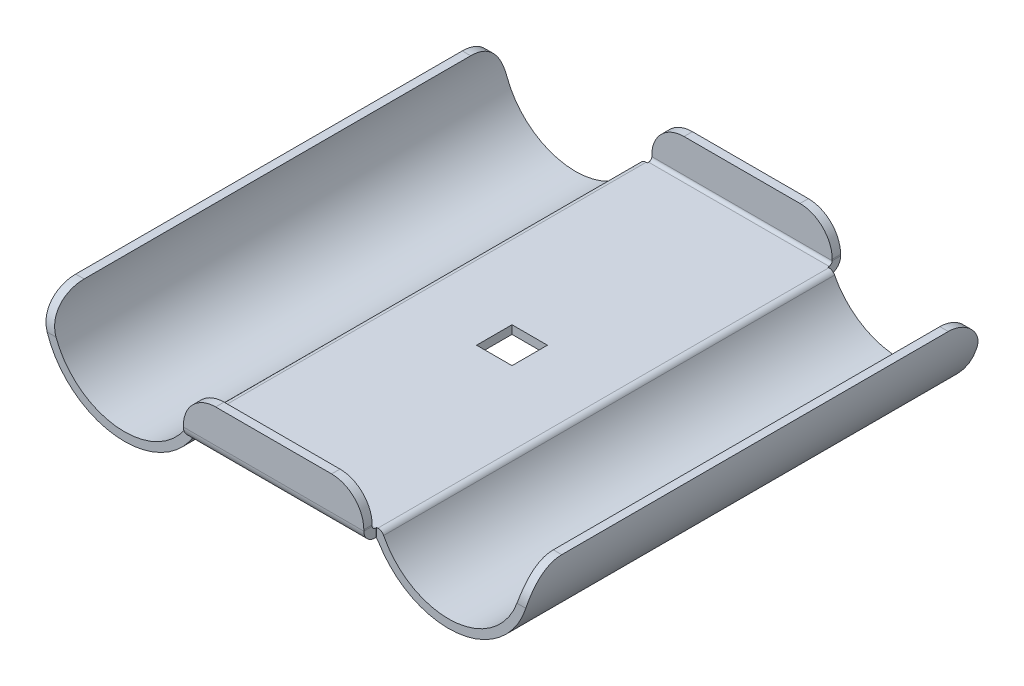
from build123d import *

# Parameters (mm, degrees)
SKETCH1_W                      = 28
SKETCH1_H                      = 74
BOSS_EXTRUDE1_DEPTH            = 1.3
EDGE_FLANGE1_STRIP_W           = 6.2
EDGE_FLANGE1_STRIP_H           = 1.3
EDGE_FLANGE1_STRIP_CUT_DEPTH   = 28
EDGE_FLANGE1_STRIP_2_W         = 6.2
EDGE_FLANGE1_STRIP_2_H         = 1.3
EDGE_FLANGE1_STRIP_CUT_2_DEPTH = 28
EDGE_FLANGE1_DEPTH             = 28
EDGE_FLANGE1_BEND_DEPTH        = 28
FILLET1_R                      = 5
SKETCH16_W                     = 5.5
SKETCH16_H                     = 5.5
CUT_EXTRUDE1_DEPTH             = 41.174618853
BOSS_EXTRUDE2_DEPTH            = 35
FILLET2_R                      = 5
FILLET3_R                      = 1


# Sheet-metal steps are written as plain solids
with BuildPart() as part:
    # Sketch1 → Boss-Extrude1 (new body)
    with BuildSketch(Plane(origin=(0, 0, 0), x_dir=(1, 0, 0), z_dir=(0, 1, 0))):
        Rectangle(SKETCH1_W, SKETCH1_H)
    extrude(amount=BOSS_EXTRUDE1_DEPTH)

    # Edge-Flange1 strip (across the edge) → Edge-Flange1 strip cut (cut)
    with BuildSketch(Plane(origin=(14, 1.3, -37), x_dir=(0, 0, 1), z_dir=(-1, 0, 0))):
        with Locations((-1.3, -0.65)):
            Rectangle(EDGE_FLANGE1_STRIP_W, EDGE_FLANGE1_STRIP_H)
    extrude(amount=EDGE_FLANGE1_STRIP_CUT_DEPTH, mode=Mode.SUBTRACT)

    # Edge-Flange1 strip 2 (across the edge) → Edge-Flange1 strip cut 2 (cut)
    with BuildSketch(Plane(origin=(-14, 1.3, 37), x_dir=(0, 0, -1), z_dir=(1, 0, 0))):
        with Locations((-1.3, -0.65)):
            Rectangle(EDGE_FLANGE1_STRIP_2_W, EDGE_FLANGE1_STRIP_2_H)
    extrude(amount=EDGE_FLANGE1_STRIP_CUT_2_DEPTH, mode=Mode.SUBTRACT)

    # Edge-Flange1 section (across the edge) → Edge-Flange1 (add)
    with BuildSketch(Plane(origin=(14, 1.3, -37), x_dir=(0, 0, 1), z_dir=(-1, 0, 0))):
        with BuildLine():
            Line((0, 0.5), (0, 5.7))
            Line((0, 5.7), (1.3, 5.7))
            Line((1.3, 5.7), (1.3, 0.5))
            ThreePointArc((1.3, 0.5), (1.446446609, 0.146446609), (1.8, 0))
            Line((1.8, 0), (1.8, -1.3))
            ThreePointArc((1.8, -1.3), (0.527207794, -0.772792206), (0, 0.5))
        make_face()
    extrude(amount=EDGE_FLANGE1_DEPTH)

    # Edge-Flange1 section 2 (across the edge) → Edge-Flange1 bend (add)
    with BuildSketch(Plane(origin=(-14, 1.3, 37), x_dir=(0, 0, -1), z_dir=(1, 0, 0))):
        with BuildLine():
            Line((0, 0.5), (0, 5.7))
            Line((0, 5.7), (1.3, 5.7))
            Line((1.3, 5.7), (1.3, 0.5))
            ThreePointArc((1.3, 0.5), (1.446446609, 0.146446609), (1.8, 0))
            Line((1.8, 0), (1.8, -1.3))
            ThreePointArc((1.8, -1.3), (0.527207794, -0.772792206), (0, 0.5))
        make_face()
    extrude(amount=EDGE_FLANGE1_BEND_DEPTH)

    # Fillet1
    fillet1_edges = [part.edges().sort_by_distance(p)[0] for p in [
        (14, 7, -36.35),
        (-14, 7, -36.35),
        (-14, 7, 36.35),
        (14, 7, 36.35),
    ]]
    fillet(fillet1_edges, radius=FILLET1_R)

    # Sketch16 → Cut-Extrude1 (cut, through all)
    with BuildSketch(Plane.XZ):
        Rectangle(SKETCH16_W, SKETCH16_H)
    extrude(amount=-CUT_EXTRUDE1_DEPTH, mode=Mode.SUBTRACT)

    # Sketch17 → Boss-Extrude2 (add, symmetric)
    with BuildSketch(Plane.XY):
        with BuildLine():
            Line((-36.411176225, 7), (-37.716721927, 7))
            ThreePointArc((-37.716721927, 7), (-28.02937954, -6.381761823), (-13.403830412, 1.3))
            Line((-13.403830412, 1.3), (-14.812491114, 1.3))
            ThreePointArc((-14.812491114, 1.3), (-28.03717688, -5.040214789), (-36.411176225, 7))
        make_face()
    boss_extrude2 = extrude(amount=BOSS_EXTRUDE2_DEPTH, both=True)

    # Mirror1: Boss-Extrude2 across plane
    add(boss_extrude2.mirror(Plane(origin=(0, 0, 0), x_dir=(0, 0, 1), z_dir=(1, 0, 0))))

    # Fillet2
    fillet2_edges = [part.edges().sort_by_distance(p)[0] for p in [
        (-37.063949076, 7, -35),
        (-37.063949076, 7, 35),
        (37.063949076, 7, 35),
        (37.063949076, 7, -35),
    ]]
    fillet(fillet2_edges, radius=FILLET2_R)

    # Fillet3
    fillet3_edges = [part.edges().sort_by_distance(p)[0] for p in [
        (-14, 0, 0),
        (-14.812491114, 1.3, 0),
        (14, 0, 0),
        (14.812491114, 1.3, 0),
    ]]
    fillet(fillet3_edges, radius=FILLET3_R)


solid = part.part
